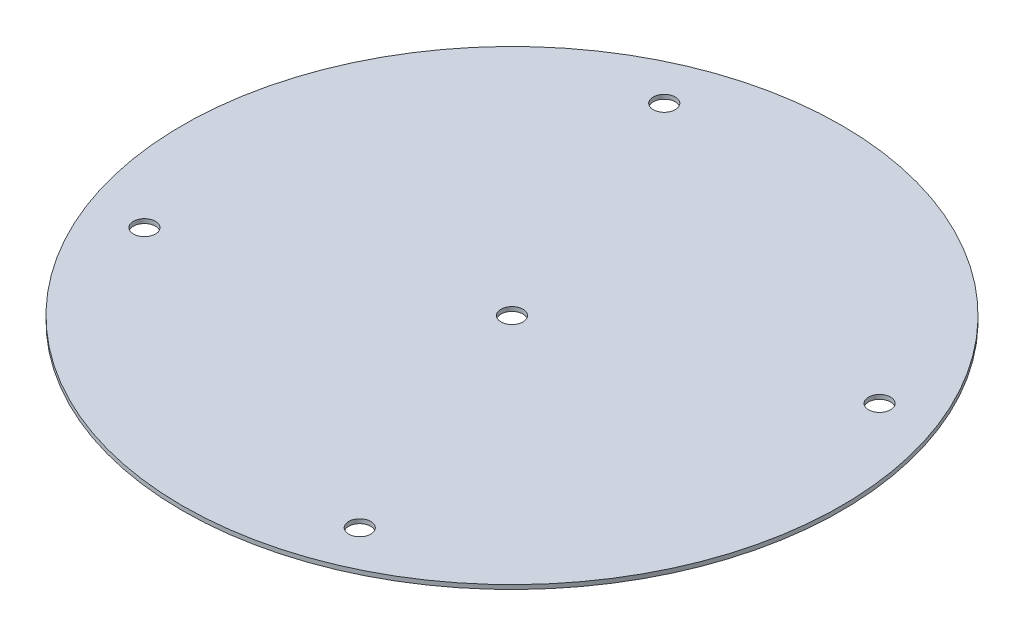
from build123d import *

# Parameters (mm, degrees)
SKETCH2_W                  = 77.55
SKETCH2_H                  = 1
F_6_0_204_DIAMETER_HOLE1_D = 5.1816
CIRPATTERN3_COUNT          = 4
F_6_0_204_DIAMETER_HOLE2_D = 5.1816


with BuildPart() as part:
    # Sketch2 → Revolve1 (revolve)
    with BuildSketch(Plane(origin=(0, 0, 0), x_dir=(0, 0, -1), z_dir=(1, 0, 0))):
        with Locations((-38.775, 0.5)):
            Rectangle(SKETCH2_W, SKETCH2_H)
    revolve(axis=Axis((0, -0.05, 0), (0, 1, 0)))

    # #6 (0.204) Diameter Hole1 (through all)
    with Locations(Plane(origin=(0, 1, 0), x_dir=(1, 0, 0), z_dir=(0, 1, 0))):
        with Locations((-25.333643223, 61.160825052)):
            f_6_0_204_diameter_hole1 = Hole(F_6_0_204_DIAMETER_HOLE1_D / 2)

    # CirPattern3: #6 (0.204) Diameter Hole1 ×4 about axis
    cirpattern3_axis = Axis((0, -0.05, 0), (0, 1, 0))
    for i in range(1, CIRPATTERN3_COUNT):
        add(f_6_0_204_diameter_hole1.rotate(cirpattern3_axis, i * 360 / CIRPATTERN3_COUNT), mode=Mode.SUBTRACT)

    # #6 (0.204) Diameter Hole2 (through all)
    with Locations(Plane(origin=(0, 1, 0), x_dir=(1, 0, 0), z_dir=(0, 1, 0))):
        with Locations((0, 0)):
            Hole(F_6_0_204_DIAMETER_HOLE2_D / 2)


solid = part.part
